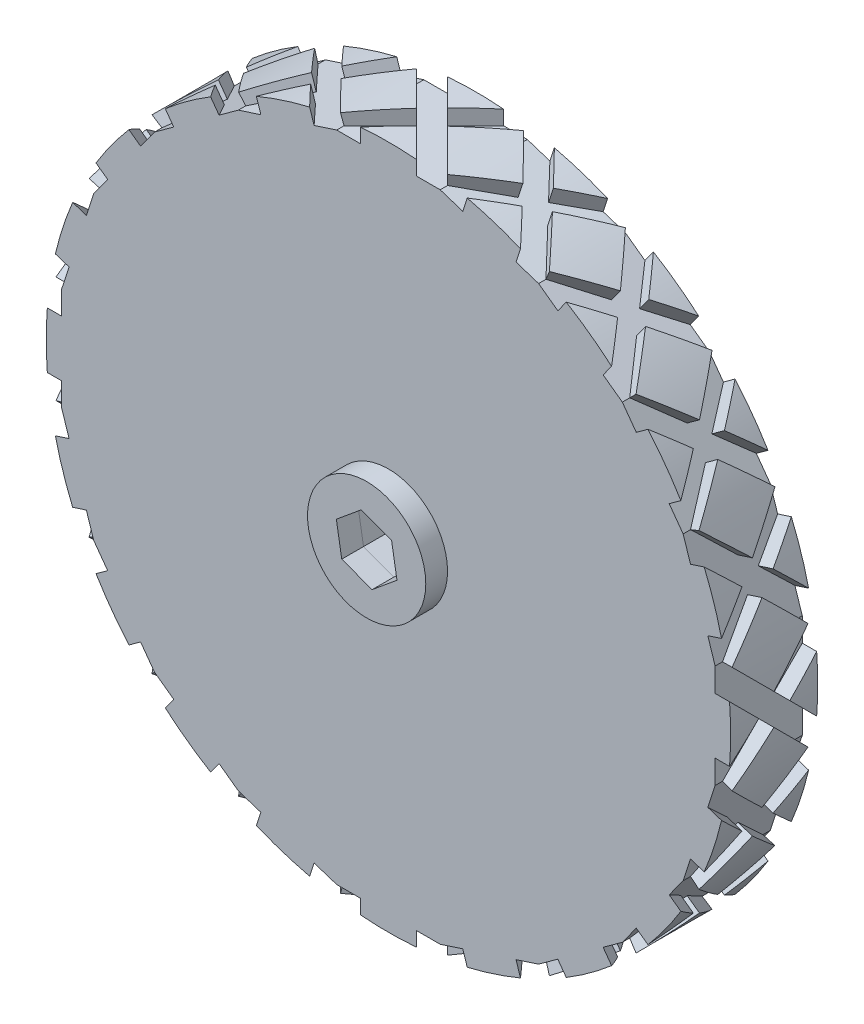
from build123d import *

# Parameters (mm, degrees)
SKETCH1_R                    = 2.5
BOSS_EXTRUDE1_DEPTH          = 1.5
SKETCH2_R                    = 11
BOSS_EXTRUDE2_DEPTH          = 3
SKETCH3_R                    = 1.9
BOSS_EXTRUDE3_DEPTH          = 0.6
CUT_EXTRUDE1_START           = -0.1
SKETCH4_R                    = 11
SKETCH4_R_2                  = 1.9
CUT_EXTRUDE1_DEPTH           = 0.1
SKETCH5_R                    = 11
SKETCH5_R_2                  = 2.5
CUT_EXTRUDE2_DEPTH           = 0.1
SKETCH8_W                    = 1
SKETCH8_H                    = 1
CIRPATTERN2_COUNT            = 20
CIRPATTERN2_COPY_1_SKETCH_W  = 1
CIRPATTERN2_COPY_1_SKETCH_H  = 1
CIRPATTERN2_COPY_2_SKETCH_W  = 1
CIRPATTERN2_COPY_2_SKETCH_H  = 1
CIRPATTERN2_COPY_3_SKETCH_W  = 1
CIRPATTERN2_COPY_3_SKETCH_H  = 1
CIRPATTERN2_COPY_4_SKETCH_W  = 1
CIRPATTERN2_COPY_4_SKETCH_H  = 1
CIRPATTERN2_COPY_5_SKETCH_W  = 1
CIRPATTERN2_COPY_5_SKETCH_H  = 1
CIRPATTERN2_COPY_6_SKETCH_W  = 1
CIRPATTERN2_COPY_6_SKETCH_H  = 1
CIRPATTERN2_COPY_7_SKETCH_W  = 1
CIRPATTERN2_COPY_7_SKETCH_H  = 1
CIRPATTERN2_COPY_8_SKETCH_W  = 1
CIRPATTERN2_COPY_8_SKETCH_H  = 1
CIRPATTERN2_COPY_9_SKETCH_W  = 1
CIRPATTERN2_COPY_9_SKETCH_H  = 1
CIRPATTERN2_COPY_10_SKETCH_W = 1
CIRPATTERN2_COPY_10_SKETCH_H = 1
CIRPATTERN2_COPY_11_SKETCH_W = 1
CIRPATTERN2_COPY_11_SKETCH_H = 1
CIRPATTERN2_COPY_12_SKETCH_W = 1
CIRPATTERN2_COPY_12_SKETCH_H = 1
CIRPATTERN2_COPY_13_SKETCH_W = 1
CIRPATTERN2_COPY_13_SKETCH_H = 1
CIRPATTERN2_COPY_14_SKETCH_W = 1
CIRPATTERN2_COPY_14_SKETCH_H = 1
CIRPATTERN2_COPY_15_SKETCH_W = 1
CIRPATTERN2_COPY_15_SKETCH_H = 1
CIRPATTERN2_COPY_16_SKETCH_W = 1
CIRPATTERN2_COPY_16_SKETCH_H = 1
CIRPATTERN2_COPY_17_SKETCH_W = 1
CIRPATTERN2_COPY_17_SKETCH_H = 1
CIRPATTERN2_COPY_18_SKETCH_W = 1
CIRPATTERN2_COPY_18_SKETCH_H = 1
CIRPATTERN2_COPY_19_SKETCH_W = 1
CIRPATTERN2_COPY_19_SKETCH_H = 1
SPLIT1_START                 = 4.4
SPLIT1_OUTLINE_R             = 1.9
SPLIT1_DEPTH                 = 0.7
SPLIT1_2_OUTLINE_R           = 1.9
SPLIT1_2_DEPTH               = 0.7
SKETCH11_R                   = 9.5
SKETCH11_R_2                 = 4
CUT_EXTRUDE4_DEPTH           = 0.4


# Read off the part's stored shape, not the designer's step: Split1
with BuildPart() as part:
    # Sketch1 → Boss-Extrude1 (new body)
    with BuildSketch(Plane.XY):
        with Locations(Location((0, 2.1, 0), (0, 0, 180))):
            Circle(SKETCH1_R)
        Polygon((0.97419257, 1.738131466), (0.800483629, 2.762741247), (-0.173708942, 3.124609781), (-0.97419257, 2.461868534), (-0.800483629, 1.437258753), (0.173708942, 1.075390219), align=None, mode=Mode.SUBTRACT)
    extrude(amount=BOSS_EXTRUDE1_DEPTH)

    # Sketch2 → Boss-Extrude2 (add)
    with BuildSketch(Plane.XY.offset(1.5)):
        with Locations((0, 2.1)):
            Circle(SKETCH2_R)
        Polygon((0.173708942, 1.075390219), (0.97419257, 1.738131466), (0.800483629, 2.762741247), (-0.173708942, 3.124609781), (-0.97419257, 2.461868534), (-0.800483629, 1.437258753), align=None, mode=Mode.SUBTRACT)
    extrude(amount=BOSS_EXTRUDE2_DEPTH)

    # Sketch3 → Boss-Extrude3 (add)
    with BuildSketch(Plane.XY.offset(4.5)):
        with Locations((0, 2.1)):
            Circle(SKETCH3_R)
        Polygon((0.800483629, 2.762741247), (-0.173708942, 3.124609781), (-0.97419257, 2.461868534), (-0.800483629, 1.437258753), (0.173708942, 1.075390219), (0.97419257, 1.738131466), align=None, mode=Mode.SUBTRACT)
    extrude(amount=BOSS_EXTRUDE3_DEPTH)

    # Sketch4 → Cut-Extrude1 (cut)
    with BuildSketch(Plane.XY.offset(4.5).offset(CUT_EXTRUDE1_START)):
        with Locations((0, 2.1)):
            Circle(SKETCH4_R)
        with Locations((0, 2.1)):
            Circle(SKETCH4_R_2, mode=Mode.SUBTRACT)
    extrude(amount=CUT_EXTRUDE1_DEPTH, mode=Mode.SUBTRACT)

    # Sketch5 → Cut-Extrude2 (cut)
    with BuildSketch(Plane(origin=(0, 0, 1.5), x_dir=(-1, 0, 0), z_dir=(0, 0, -1))):
        with Locations((0, 2.1)):
            Circle(SKETCH5_R)
        with Locations((0, 2.1)):
            Circle(SKETCH5_R_2, mode=Mode.SUBTRACT)
    extrude(amount=-CUT_EXTRUDE2_DEPTH, mode=Mode.SUBTRACT)

    # Cut-Sweep1: sweep along a path in Sketch9
    with BuildLine(Plane(origin=(0, -10, 0), x_dir=(1, 0, 0), z_dir=(0, 1, 0))) as cut_sweep1_path:
        Line((3.304024728, 0.304024728), (0, -3))
        Line((0, -3), (-3.200422555, -6.200422555))
    # Sketch8 → Cut-Sweep1 (sweep, cut)
    with BuildSketch(Plane(origin=(0, 0, 3), x_dir=(-1, 0, 0), z_dir=(0, 0, -1))):
        with Locations((0, -8.9)):
            Rectangle(SKETCH8_W, SKETCH8_H)
    cut_sweep1 = sweep(path=cut_sweep1_path.line, mode=Mode.SUBTRACT)

    # Mirror1: Cut-Sweep1 across plane
    add(cut_sweep1.mirror(Plane(origin=(0, 0, 0), x_dir=(0, 0, 1), z_dir=(1, 0, 0))), mode=Mode.SUBTRACT)

    # CirPattern2: Cut-Sweep1 ×20 about axis
    cirpattern2_axis = Axis((0, 2.1, 0), (0, 0, 1))
    for i in range(1, CIRPATTERN2_COUNT):
        add(cut_sweep1.rotate(cirpattern2_axis, i * 360 / CIRPATTERN2_COUNT), mode=Mode.SUBTRACT)

    # CirPattern2 copy 1: sweep along a path in CirPattern2 copy 1 path
    with BuildLine(Plane(origin=(3.739105632, -9.407783847, 0), x_dir=(-0.9510565162951535, -0.3090169943749474, 0), z_dir=(-0.3090169943749474, 0.9510565162951535, 0))) as cirpattern2_copy_1_path:
        Line((3.304024728, -0.304024728), (0, 3))
        Line((0, 3), (-3.200422555, 6.200422555))
    # CirPattern2 copy 1 sketch → CirPattern2 copy 1 (sweep, cut)
    with BuildSketch(Plane(origin=(0.648935688, 0.102781316, 3), x_dir=(0.9510565162951535, 0.3090169943749474, 0), z_dir=(0, 0, -1))):
        with Locations((0, 8.9)):
            Rectangle(CIRPATTERN2_COPY_1_SKETCH_W, CIRPATTERN2_COPY_1_SKETCH_H)
    sweep(path=cirpattern2_copy_1_path.line, mode=Mode.SUBTRACT)

    # CirPattern2 copy 2: sweep along a path in CirPattern2 copy 2 path
    with BuildLine(Plane(origin=(7.112201553, -7.689105632, 0), x_dir=(-0.8090169943749475, -0.5877852522924731, 0), z_dir=(-0.5877852522924731, 0.8090169943749475, 0))) as cirpattern2_copy_2_path:
        Line((3.304024728, -0.304024728), (0, 3))
        Line((0, 3), (-3.200422555, 6.200422555))
    # CirPattern2 copy 2 sketch → CirPattern2 copy 2 (sweep, cut)
    with BuildSketch(Plane(origin=(1.23434903, 0.401064312, 3), x_dir=(0.8090169943749475, 0.5877852522924731, 0), z_dir=(0, 0, -1))):
        with Locations((0, 8.9)):
            Rectangle(CIRPATTERN2_COPY_2_SKETCH_W, CIRPATTERN2_COPY_2_SKETCH_H)
    sweep(path=cirpattern2_copy_2_path.line, mode=Mode.SUBTRACT)

    # CirPattern2 copy 3: sweep along a path in CirPattern2 copy 3 path
    with BuildLine(Plane(origin=(9.789105632, -5.012201553, 0), x_dir=(-0.5877852522924731, -0.8090169943749475, 0), z_dir=(-0.8090169943749475, 0.5877852522924731, 0))) as cirpattern2_copy_3_path:
        Line((3.304024728, -0.304024728), (0, 3))
        Line((0, 3), (-3.200422555, 6.200422555))
    # CirPattern2 copy 3 sketch → CirPattern2 copy 3 (sweep, cut)
    with BuildSketch(Plane(origin=(1.698935688, 0.86565097, 3), x_dir=(0.5877852522924731, 0.8090169943749475, 0), z_dir=(0, 0, -1))):
        with Locations((0, 8.9)):
            Rectangle(CIRPATTERN2_COPY_3_SKETCH_W, CIRPATTERN2_COPY_3_SKETCH_H)
    sweep(path=cirpattern2_copy_3_path.line, mode=Mode.SUBTRACT)

    # CirPattern2 copy 4: sweep along a path in CirPattern2 copy 4 path
    with BuildLine(Plane(origin=(11.507783847, -1.639105632, 0), x_dir=(-0.30901699437494745, -0.9510565162951535, 0), z_dir=(-0.9510565162951535, 0.30901699437494745, 0))) as cirpattern2_copy_4_path:
        Line((3.304024728, -0.304024728), (0, 3))
        Line((0, 3), (-3.200422555, 6.200422555))
    # CirPattern2 copy 4 sketch → CirPattern2 copy 4 (sweep, cut)
    with BuildSketch(Plane(origin=(1.997218684, 1.451064312, 3), x_dir=(0.30901699437494745, 0.9510565162951535, 0), z_dir=(0, 0, -1))):
        with Locations((0, 8.9)):
            Rectangle(CIRPATTERN2_COPY_4_SKETCH_W, CIRPATTERN2_COPY_4_SKETCH_H)
    sweep(path=cirpattern2_copy_4_path.line, mode=Mode.SUBTRACT)

    # CirPattern2 copy 5: sweep along a path in CirPattern2 copy 5 path
    with BuildLine(Plane(origin=(12.1, 2.1, 0), x_dir=(0, -1, 0), z_dir=(-1, 0, 0))) as cirpattern2_copy_5_path:
        Line((3.304024728, -0.304024728), (0, 3))
        Line((0, 3), (-3.200422555, 6.200422555))
    # CirPattern2 copy 5 sketch → CirPattern2 copy 5 (sweep, cut)
    with BuildSketch(Plane(origin=(2.1, 2.1, 3), x_dir=(0, 1, 0), z_dir=(0, 0, -1))):
        with Locations((0, 8.9)):
            Rectangle(CIRPATTERN2_COPY_5_SKETCH_W, CIRPATTERN2_COPY_5_SKETCH_H)
    sweep(path=cirpattern2_copy_5_path.line, mode=Mode.SUBTRACT)

    # CirPattern2 copy 6: sweep along a path in CirPattern2 copy 6 path
    with BuildLine(Plane(origin=(11.507783847, 5.839105632, 0), x_dir=(0.30901699437494734, -0.9510565162951536, 0), z_dir=(-0.9510565162951536, -0.30901699437494734, 0))) as cirpattern2_copy_6_path:
        Line((3.304024728, -0.304024728), (0, 3))
        Line((0, 3), (-3.200422555, 6.200422555))
    # CirPattern2 copy 6 sketch → CirPattern2 copy 6 (sweep, cut)
    with BuildSketch(Plane(origin=(1.997218684, 2.748935688, 3), x_dir=(-0.30901699437494734, 0.9510565162951536, 0), z_dir=(0, 0, -1))):
        with Locations((0, 8.9)):
            Rectangle(CIRPATTERN2_COPY_6_SKETCH_W, CIRPATTERN2_COPY_6_SKETCH_H)
    sweep(path=cirpattern2_copy_6_path.line, mode=Mode.SUBTRACT)

    # CirPattern2 copy 7: sweep along a path in CirPattern2 copy 7 path
    with BuildLine(Plane(origin=(9.789105632, 9.212201553, 0), x_dir=(0.587785252292473, -0.8090169943749475, 0), z_dir=(-0.8090169943749475, -0.587785252292473, 0))) as cirpattern2_copy_7_path:
        Line((3.304024728, -0.304024728), (0, 3))
        Line((0, 3), (-3.200422555, 6.200422555))
    # CirPattern2 copy 7 sketch → CirPattern2 copy 7 (sweep, cut)
    with BuildSketch(Plane(origin=(1.698935688, 3.33434903, 3), x_dir=(-0.587785252292473, 0.8090169943749475, 0), z_dir=(0, 0, -1))):
        with Locations((0, 8.9)):
            Rectangle(CIRPATTERN2_COPY_7_SKETCH_W, CIRPATTERN2_COPY_7_SKETCH_H)
    sweep(path=cirpattern2_copy_7_path.line, mode=Mode.SUBTRACT)

    # CirPattern2 copy 8: sweep along a path in CirPattern2 copy 8 path
    with BuildLine(Plane(origin=(7.112201553, 11.889105632, 0), x_dir=(0.8090169943749473, -0.5877852522924732, 0), z_dir=(-0.5877852522924732, -0.8090169943749473, 0))) as cirpattern2_copy_8_path:
        Line((3.304024728, -0.304024728), (0, 3))
        Line((0, 3), (-3.200422555, 6.200422555))
    # CirPattern2 copy 8 sketch → CirPattern2 copy 8 (sweep, cut)
    with BuildSketch(Plane(origin=(1.23434903, 3.798935688, 3), x_dir=(-0.8090169943749473, 0.5877852522924732, 0), z_dir=(0, 0, -1))):
        with Locations((0, 8.9)):
            Rectangle(CIRPATTERN2_COPY_8_SKETCH_W, CIRPATTERN2_COPY_8_SKETCH_H)
    sweep(path=cirpattern2_copy_8_path.line, mode=Mode.SUBTRACT)

    # CirPattern2 copy 9: sweep along a path in CirPattern2 copy 9 path
    with BuildLine(Plane(origin=(3.739105632, 13.607783847, 0), x_dir=(0.9510565162951535, -0.3090169943749475, 0), z_dir=(-0.3090169943749475, -0.9510565162951535, 0))) as cirpattern2_copy_9_path:
        Line((3.304024728, -0.304024728), (0, 3))
        Line((0, 3), (-3.200422555, 6.200422555))
    # CirPattern2 copy 9 sketch → CirPattern2 copy 9 (sweep, cut)
    with BuildSketch(Plane(origin=(0.648935688, 4.097218684, 3), x_dir=(-0.9510565162951535, 0.3090169943749475, 0), z_dir=(0, 0, -1))):
        with Locations((0, 8.9)):
            Rectangle(CIRPATTERN2_COPY_9_SKETCH_W, CIRPATTERN2_COPY_9_SKETCH_H)
    sweep(path=cirpattern2_copy_9_path.line, mode=Mode.SUBTRACT)

    # CirPattern2 copy 10: sweep along a path in CirPattern2 copy 10 path
    with BuildLine(Plane.XZ.offset(-14.2)) as cirpattern2_copy_10_path:
        Line((3.304024728, -0.304024728), (0, 3))
        Line((0, 3), (-3.200422555, 6.200422555))
    # CirPattern2 copy 10 sketch → CirPattern2 copy 10 (sweep, cut)
    with BuildSketch(Plane(origin=(0, 4.2, 3), x_dir=(-1, 0, 0), z_dir=(0, 0, -1))):
        with Locations((0, 8.9)):
            Rectangle(CIRPATTERN2_COPY_10_SKETCH_W, CIRPATTERN2_COPY_10_SKETCH_H)
    sweep(path=cirpattern2_copy_10_path.line, mode=Mode.SUBTRACT)

    # CirPattern2 copy 11: sweep along a path in CirPattern2 copy 11 path
    with BuildLine(Plane(origin=(-3.739105632, 13.607783847, 0), x_dir=(0.9510565162951536, 0.3090169943749473, 0), z_dir=(0.3090169943749473, -0.9510565162951536, 0))) as cirpattern2_copy_11_path:
        Line((3.304024728, -0.304024728), (0, 3))
        Line((0, 3), (-3.200422555, 6.200422555))
    # CirPattern2 copy 11 sketch → CirPattern2 copy 11 (sweep, cut)
    with BuildSketch(Plane(origin=(-0.648935688, 4.097218684, 3), x_dir=(-0.9510565162951536, -0.3090169943749473, 0), z_dir=(0, 0, -1))):
        with Locations((0, 8.9)):
            Rectangle(CIRPATTERN2_COPY_11_SKETCH_W, CIRPATTERN2_COPY_11_SKETCH_H)
    sweep(path=cirpattern2_copy_11_path.line, mode=Mode.SUBTRACT)

    # CirPattern2 copy 12: sweep along a path in CirPattern2 copy 12 path
    with BuildLine(Plane(origin=(-7.112201553, 11.889105632, 0), x_dir=(0.8090169943749476, 0.587785252292473, 0), z_dir=(0.587785252292473, -0.8090169943749476, 0))) as cirpattern2_copy_12_path:
        Line((3.304024728, -0.304024728), (0, 3))
        Line((0, 3), (-3.200422555, 6.200422555))
    # CirPattern2 copy 12 sketch → CirPattern2 copy 12 (sweep, cut)
    with BuildSketch(Plane(origin=(-1.23434903, 3.798935688, 3), x_dir=(-0.8090169943749476, -0.587785252292473, 0), z_dir=(0, 0, -1))):
        with Locations((0, 8.9)):
            Rectangle(CIRPATTERN2_COPY_12_SKETCH_W, CIRPATTERN2_COPY_12_SKETCH_H)
    sweep(path=cirpattern2_copy_12_path.line, mode=Mode.SUBTRACT)

    # CirPattern2 copy 13: sweep along a path in CirPattern2 copy 13 path
    with BuildLine(Plane(origin=(-9.789105632, 9.212201553, 0), x_dir=(0.5877852522924732, 0.8090169943749473, 0), z_dir=(0.8090169943749473, -0.5877852522924732, 0))) as cirpattern2_copy_13_path:
        Line((3.304024728, -0.304024728), (0, 3))
        Line((0, 3), (-3.200422555, 6.200422555))
    # CirPattern2 copy 13 sketch → CirPattern2 copy 13 (sweep, cut)
    with BuildSketch(Plane(origin=(-1.698935688, 3.33434903, 3), x_dir=(-0.5877852522924732, -0.8090169943749473, 0), z_dir=(0, 0, -1))):
        with Locations((0, 8.9)):
            Rectangle(CIRPATTERN2_COPY_13_SKETCH_W, CIRPATTERN2_COPY_13_SKETCH_H)
    sweep(path=cirpattern2_copy_13_path.line, mode=Mode.SUBTRACT)

    # CirPattern2 copy 14: sweep along a path in CirPattern2 copy 14 path
    with BuildLine(Plane(origin=(-11.507783847, 5.839105632, 0), x_dir=(0.30901699437494756, 0.9510565162951535, 0), z_dir=(0.9510565162951535, -0.30901699437494756, 0))) as cirpattern2_copy_14_path:
        Line((3.304024728, -0.304024728), (0, 3))
        Line((0, 3), (-3.200422555, 6.200422555))
    # CirPattern2 copy 14 sketch → CirPattern2 copy 14 (sweep, cut)
    with BuildSketch(Plane(origin=(-1.997218684, 2.748935688, 3), x_dir=(-0.30901699437494756, -0.9510565162951535, 0), z_dir=(0, 0, -1))):
        with Locations((0, 8.9)):
            Rectangle(CIRPATTERN2_COPY_14_SKETCH_W, CIRPATTERN2_COPY_14_SKETCH_H)
    sweep(path=cirpattern2_copy_14_path.line, mode=Mode.SUBTRACT)

    # CirPattern2 copy 15: sweep along a path in CirPattern2 copy 15 path
    with BuildLine(Plane(origin=(-12.1, 2.1, 0), x_dir=(0, 1, 0), z_dir=(1, 0, 0))) as cirpattern2_copy_15_path:
        Line((3.304024728, -0.304024728), (0, 3))
        Line((0, 3), (-3.200422555, 6.200422555))
    # CirPattern2 copy 15 sketch → CirPattern2 copy 15 (sweep, cut)
    with BuildSketch(Plane(origin=(-2.1, 2.1, 3), x_dir=(0, -1, 0), z_dir=(0, 0, -1))):
        with Locations((0, 8.9)):
            Rectangle(CIRPATTERN2_COPY_15_SKETCH_W, CIRPATTERN2_COPY_15_SKETCH_H)
    sweep(path=cirpattern2_copy_15_path.line, mode=Mode.SUBTRACT)

    # CirPattern2 copy 16: sweep along a path in CirPattern2 copy 16 path
    with BuildLine(Plane(origin=(-11.507783847, -1.639105632, 0), x_dir=(-0.30901699437494723, 0.9510565162951536, 0), z_dir=(0.9510565162951536, 0.30901699437494723, 0))) as cirpattern2_copy_16_path:
        Line((3.304024728, -0.304024728), (0, 3))
        Line((0, 3), (-3.200422555, 6.200422555))
    # CirPattern2 copy 16 sketch → CirPattern2 copy 16 (sweep, cut)
    with BuildSketch(Plane(origin=(-1.997218684, 1.451064312, 3), x_dir=(0.30901699437494723, -0.9510565162951536, 0), z_dir=(0, 0, -1))):
        with Locations((0, 8.9)):
            Rectangle(CIRPATTERN2_COPY_16_SKETCH_W, CIRPATTERN2_COPY_16_SKETCH_H)
    sweep(path=cirpattern2_copy_16_path.line, mode=Mode.SUBTRACT)

    # CirPattern2 copy 17: sweep along a path in CirPattern2 copy 17 path
    with BuildLine(Plane(origin=(-9.789105632, -5.012201553, 0), x_dir=(-0.5877852522924729, 0.8090169943749476, 0), z_dir=(0.8090169943749476, 0.5877852522924729, 0))) as cirpattern2_copy_17_path:
        Line((3.304024728, -0.304024728), (0, 3))
        Line((0, 3), (-3.200422555, 6.200422555))
    # CirPattern2 copy 17 sketch → CirPattern2 copy 17 (sweep, cut)
    with BuildSketch(Plane(origin=(-1.698935688, 0.86565097, 3), x_dir=(0.5877852522924729, -0.8090169943749476, 0), z_dir=(0, 0, -1))):
        with Locations((0, 8.9)):
            Rectangle(CIRPATTERN2_COPY_17_SKETCH_W, CIRPATTERN2_COPY_17_SKETCH_H)
    sweep(path=cirpattern2_copy_17_path.line, mode=Mode.SUBTRACT)

    # CirPattern2 copy 18: sweep along a path in CirPattern2 copy 18 path
    with BuildLine(Plane(origin=(-7.112201553, -7.689105632, 0), x_dir=(-0.8090169943749473, 0.5877852522924734, 0), z_dir=(0.5877852522924734, 0.8090169943749473, 0))) as cirpattern2_copy_18_path:
        Line((3.304024728, -0.304024728), (0, 3))
        Line((0, 3), (-3.200422555, 6.200422555))
    # CirPattern2 copy 18 sketch → CirPattern2 copy 18 (sweep, cut)
    with BuildSketch(Plane(origin=(-1.23434903, 0.401064312, 3), x_dir=(0.8090169943749473, -0.5877852522924734, 0), z_dir=(0, 0, -1))):
        with Locations((0, 8.9)):
            Rectangle(CIRPATTERN2_COPY_18_SKETCH_W, CIRPATTERN2_COPY_18_SKETCH_H)
    sweep(path=cirpattern2_copy_18_path.line, mode=Mode.SUBTRACT)

    # CirPattern2 copy 19: sweep along a path in CirPattern2 copy 19 path
    with BuildLine(Plane(origin=(-3.739105632, -9.407783847, 0), x_dir=(-0.9510565162951535, 0.3090169943749476, 0), z_dir=(0.3090169943749476, 0.9510565162951535, 0))) as cirpattern2_copy_19_path:
        Line((3.304024728, -0.304024728), (0, 3))
        Line((0, 3), (-3.200422555, 6.200422555))
    # CirPattern2 copy 19 sketch → CirPattern2 copy 19 (sweep, cut)
    with BuildSketch(Plane(origin=(-0.648935688, 0.102781316, 3), x_dir=(0.9510565162951535, -0.3090169943749476, 0), z_dir=(0, 0, -1))):
        with Locations((0, 8.9)):
            Rectangle(CIRPATTERN2_COPY_19_SKETCH_W, CIRPATTERN2_COPY_19_SKETCH_H)
    sweep(path=cirpattern2_copy_19_path.line, mode=Mode.SUBTRACT)

    # Split1 outline → Split1 (cut)
    with BuildSketch(Plane.XY.offset(SPLIT1_START)):
        with Locations((0, 2.1)):
            Circle(SPLIT1_OUTLINE_R)
        Polygon((0.800483629, 2.762741247), (0.97419257, 1.738131466), (0.173708942, 1.075390219), (-0.800483629, 1.437258753), (-0.97419257, 2.461868534), (-0.173708942, 3.124609781), align=None, mode=Mode.SUBTRACT)
    extrude(amount=SPLIT1_DEPTH, mode=Mode.SUBTRACT)

    # Sketch11 → Cut-Extrude4 (cut)
    with BuildSketch(Plane(origin=(0, 0, 1.6), x_dir=(-1, 0, 0), z_dir=(0, 0, -1))):
        with Locations((0, 2.1)):
            Circle(SKETCH11_R)
        with Locations((0, 2.1)):
            Circle(SKETCH11_R_2, mode=Mode.SUBTRACT)
    extrude(amount=-CUT_EXTRUDE4_DEPTH, mode=Mode.SUBTRACT)


with BuildPart() as body_2:
    # Split1 2 outline → Split1 2 (new body)
    with BuildSketch(Plane.XY.offset(SPLIT1_START)):
        with Locations((0, 2.1)):
            Circle(SPLIT1_2_OUTLINE_R)
        Polygon((0.800483629, 2.762741247), (0.97419257, 1.738131466), (0.173708942, 1.075390219), (-0.800483629, 1.437258753), (-0.97419257, 2.461868534), (-0.173708942, 3.124609781), align=None, mode=Mode.SUBTRACT)
    extrude(amount=SPLIT1_2_DEPTH)


solid = Compound([part.part, body_2.part])
